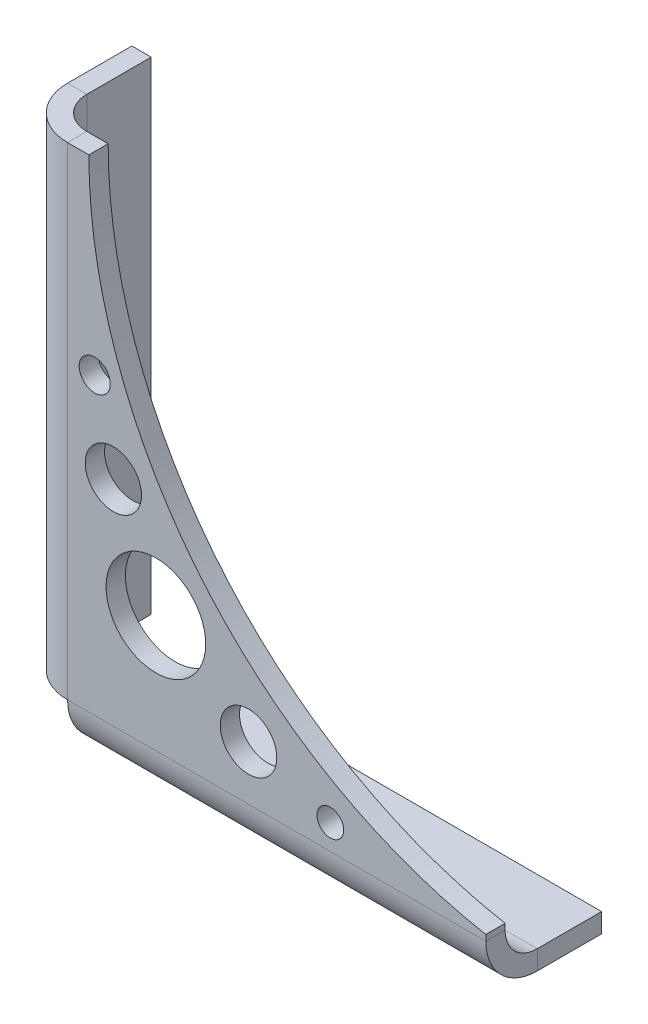
from build123d import *

# Parameters (mm, degrees)
SALIENTE_EXTRUIR1_DEPTH       = 3
CROQUIS2_R                    = 4.148409518
CROQUIS2_R_2                  = 8.791376577
CROQUIS2_R_3                  = 15.481976199
CROQUIS2_R_4                  = 8.738232185
CROQUIS2_R_5                  = 4.833412798
CORTAR_EXTRUIR1_DEPTH         = 3
CONVERTIR_S_LIDO1_START       = 3
CONVERTIR_S_LIDO1_OUTLINE_R   = 15.481976199
CONVERTIR_S_LIDO1_OUTLINE_R_2 = 8.791376577
CONVERTIR_S_LIDO1_OUTLINE_R_3 = 8.738232185
CONVERTIR_S_LIDO1_OUTLINE_R_4 = 4.148409518
CONVERTIR_S_LIDO1_OUTLINE_R_5 = 4.833412798
CONVERTIR_S_LIDO1_DEPTH       = 3
BRIDA_DE_ARISTA1_DEPTH        = 130
BRIDA_DE_ARISTA2_DEPTH        = 150


# Read off the part's stored shape, not the designer's step: Convertir-Sólido1
# Sheet-metal steps are written as plain solids
with BuildPart() as part:
    # Croquis1 → Saliente-Extruir1 (new body)
    with BuildSketch(Plane.XY):
        with BuildLine():
            Line((-53.499641927, 123.733441258), (-53.499641927, -26.266558742))
            Line((-53.499641927, -26.266558742), (76.500358073, -26.266558742))
            Line((76.500358073, -26.266558742), (76.500358073, -24.4289598))
            ThreePointArc((76.500358073, -24.4289598), (-12.000669933, 27.327433669), (-46.886740562, 123.733441258))
            Line((-46.886740562, 123.733441258), (-53.499641927, 123.733441258))
        make_face()
    extrude(amount=SALIENTE_EXTRUIR1_DEPTH)

    # Croquis2 → Cortar-Extruir1 (cut)
    with BuildSketch(Plane.XY.offset(3)):
        with Locations((28.189071336, -18.481702035)):
            Circle(CROQUIS2_R)
        with Locations((2.737394478, -9.389080565)):
            Circle(CROQUIS2_R_2)
        with Locations((-26.049076551, 10.185293851)):
            Circle(CROQUIS2_R_3)
        with Locations((-39.267642342, 40.245791579)):
            Circle(CROQUIS2_R_4)
        with Locations((-45.062734708, 65.365084268)):
            Circle(CROQUIS2_R_5)
    extrude(amount=-CORTAR_EXTRUIR1_DEPTH, mode=Mode.SUBTRACT)

    # Convertir-Sólido1 outline → Convertir-Sólido1 (add)
    with BuildSketch(Plane.XY.offset(CONVERTIR_S_LIDO1_START)):
        with BuildLine():
            Line((-53.499641927, -26.266558742), (76.500358073, -26.266558742))
            Line((76.500358073, -26.266558742), (76.500358073, -24.4289598))
            ThreePointArc((76.500358073, -24.4289598), (-12.000669933, 27.327433669), (-46.886740562, 123.733441258))
            Line((-46.886740562, 123.733441258), (-53.499641927, 123.733441258))
            Line((-53.499641927, 123.733441258), (-53.499641927, -26.266558742))
        make_face()
        with Locations((-26.049076551, 10.185293851)):
            Circle(CONVERTIR_S_LIDO1_OUTLINE_R, mode=Mode.SUBTRACT)
        with Locations((2.737394478, -9.389080565)):
            Circle(CONVERTIR_S_LIDO1_OUTLINE_R_2, mode=Mode.SUBTRACT)
        with Locations((-39.267642342, 40.245791579)):
            Circle(CONVERTIR_S_LIDO1_OUTLINE_R_3, mode=Mode.SUBTRACT)
        with Locations((28.189071336, -18.481702035)):
            Circle(CONVERTIR_S_LIDO1_OUTLINE_R_4, mode=Mode.SUBTRACT)
        with Locations((-45.062734708, 65.365084268)):
            Circle(CONVERTIR_S_LIDO1_OUTLINE_R_5, mode=Mode.SUBTRACT)
    extrude(amount=CONVERTIR_S_LIDO1_DEPTH)

    # Brida de arista1 section (across the edge) → Brida de arista1 (add)
    with BuildSketch(Plane(origin=(76.500358073, -36.266558742, 0), x_dir=(0, 1, 0), z_dir=(-1, 0, 0))):
        with BuildLine():
            Line((-6, 10), (-6, 30))
            Line((-6, 30), (0, 30))
            Line((0, 30), (0, 10))
            ThreePointArc((0, 10), (2.928932188, 2.928932188), (10, 0))
            Line((10, 0), (10, -6))
            ThreePointArc((10, -6), (-1.313708499, -1.313708499), (-6, 10))
        make_face()
    extrude(amount=BRIDA_DE_ARISTA1_DEPTH)

    # Brida de arista2 section (across the edge) → Brida de arista2 (add)
    with BuildSketch(Plane(origin=(-63.499641927, -26.266558742, 0), x_dir=(1, 0, 0), z_dir=(0, 1, 0))):
        with BuildLine():
            Line((-6, 10), (-6, 30))
            Line((-6, 30), (0, 30))
            Line((0, 30), (0, 10))
            ThreePointArc((0, 10), (2.928932188, 2.928932188), (10, 0))
            Line((10, 0), (10, -6))
            ThreePointArc((10, -6), (-1.313708499, -1.313708499), (-6, 10))
        make_face()
    extrude(amount=BRIDA_DE_ARISTA2_DEPTH)


solid = part.part
